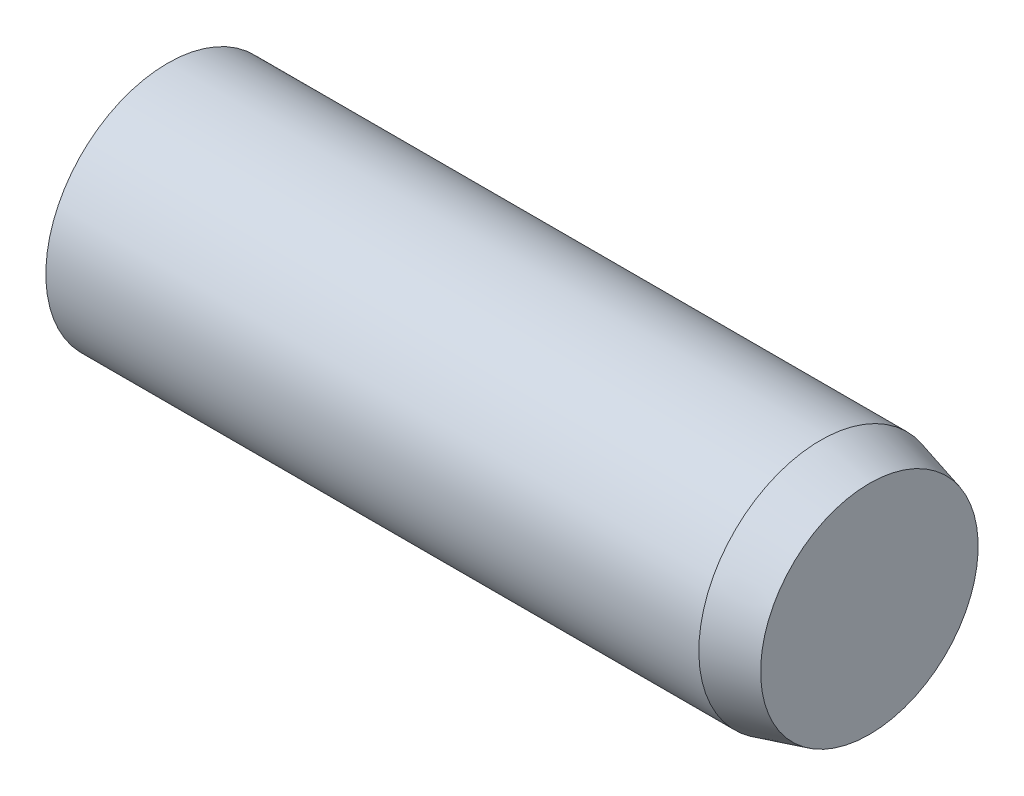
from build123d import *


with BuildPart() as part:
    # BodySke → Body (revolve)
    with BuildSketch(Plane.XY):
        with BuildLine():
            Line((28, 5), (30, 4.464101615))
            Line((30, 4.464101615), (30, 0))
            Line((30, 0), (0, 0))
            ThreePointArc((0, 0), (0.30419989, 2.570992026), (1.2, 5))
            Line((1.2, 5), (28, 5))
        make_face()
    revolve(axis=Axis((0, 0, 0), (1, 0, 0)))


solid = part.part
